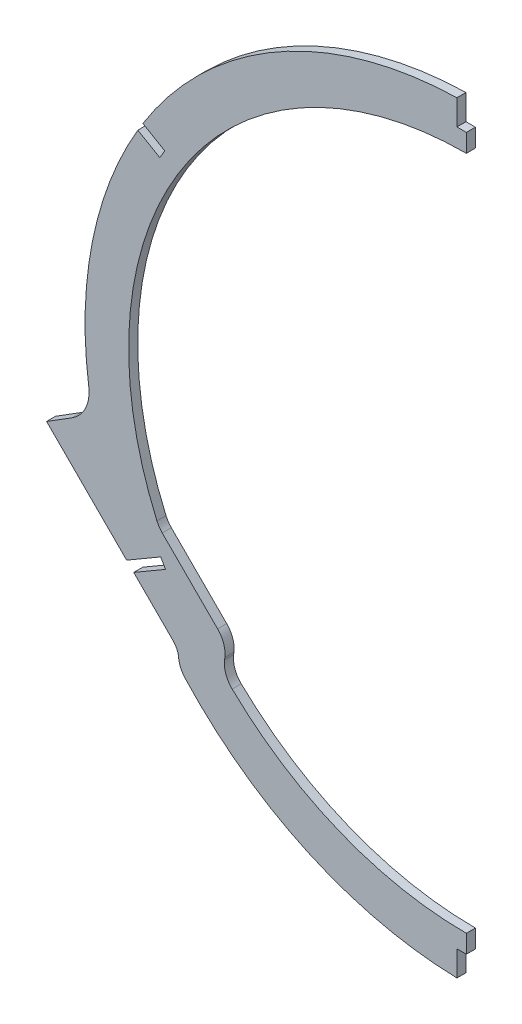
from build123d import *

# Parameters (mm, degrees)
BOSS_EXTRUDE1_DEPTH = 1.5875
CUT_EXTRUDE1_DEPTH  = 3.175
FILLET1_R           = 8.89
SKETCH3_W           = 234.443386257
SKETCH3_H           = 422.563019086
CUT_EXTRUDE2_DEPTH  = 206.876411182
BOSS_EXTRUDE2_DEPTH = 1.5875
FILLET2_R           = 6.35
FILLET3_R           = 12.7
SKETCH6_W           = 3.302
SKETCH6_H           = 12.7
CUT_EXTRUDE3_DEPTH  = 215.861709895


with BuildPart() as part:
    # Sketch1 → Boss-Extrude1 (new, symmetric)
    with BuildSketch(Plane.XY):
        with BuildLine():
            Line((-120.187952283, -34.272453), (-99.98237601, -54.478029272))
            Line((-99.98237601, -54.478029272), (-101.142590553, -63.40953887))
            ThreePointArc((-101.142590553, -63.40953887), (-81.179103762, -82.298079227), (-57.767453, -96.692952283))
            ThreePointArc((-57.767453, -96.692952283), (94.292689271, 117.787689271), (-120.187952283, -34.272453))
        make_face()
    extrude(amount=BOSS_EXTRUDE1_DEPTH, both=True)

    # Sketch2 → Cut-Extrude1 (cut)
    with BuildSketch(Plane.XY.offset(1.5875)):
        with BuildLine():
            Line((-83.903310386, -49.004480206), (-85.12178765, -58.384505172))
            ThreePointArc((-85.12178765, -58.384505172), (97.723123527, 89.828726174), (-107.51910025, -25.388690342))
            Line((-107.51910025, -25.388690342), (-83.903310386, -49.004480206))
        make_face()
    extrude(amount=-CUT_EXTRUDE1_DEPTH, mode=Mode.SUBTRACT)

    # Fillet1
    fillet1_edges = [part.edges().sort_by_distance(p)[0] for p in [
        (-83.903310386, -49.004480206, 0),
        (-107.51910025, -25.388690342, 0),
        (-85.12178765, -58.384505172, 0),
        (-99.98237601, -54.478029272, -0.79375),
        (-120.187952283, -34.272453, -0.79375),
        (-101.142590553, -63.40953887, -0.79375),
    ]]
    fillet(fillet1_edges, radius=FILLET1_R)

    # Sketch3 → Cut-Extrude2 (cut, through all)
    with BuildSketch(Plane(origin=(0, 0, 0), x_dir=(0, 0, -1), z_dir=(1, 0, 0))):
        with Locations((10.168628802, 16.433452221)):
            Rectangle(SKETCH3_W, SKETCH3_H)
    extrude(amount=CUT_EXTRUDE2_DEPTH, mode=Mode.SUBTRACT)

    # Sketch5 → Boss-Extrude2 (add, symmetric)
    with BuildSketch(Plane.XY):
        Polygon((-146.81661939, -13.003405573), (-125.293457687, 0.445758531), (-91.969146245, -50.60762416), (-100.600425128, -59.235866221), align=None)
    extrude(amount=BOSS_EXTRUDE2_DEPTH, both=True)

    # Fillet2
    # the kernel refuses this fillet: 6.35 mm, written as the material it adds along each edge
    with BuildSketch(Plane(origin=(-100.600425128, -59.235866221, -1.5875), x_dir=(-0.03079411224323655, -0.9995257488685076, 0), z_dir=(0, 0, 1)), Plane(origin=(-100.600425128, -59.235866221, 0), x_dir=(-0.03079411224323655, -0.9995257488685076, 0), z_dir=(0, 0, 1))) as fillet2_piece_1:
        with BuildLine():
            CenterArc((2.784435169, -6.30796831), FILLET2_R, 96.595975588, 40.158594829)
            Line((-1.841067542, -1.957425279), (-2.303617813, -1.522370976))
            Line((-2.303617813, -1.522370976), (-0.462550271, 0.435054303))
            Line((-0.462550271, 0.435054303), (0.062369909, 0.63192958))
            ThreePointArc((0.062369909, 0.63192958), (0.223047541, 0.61607109), (1.982086545, 0.630796831))
            Line((1.982086545, 0.630796831), (2.055027329, 0))
        make_face()
    extrude(amount=1.5875)

    # Fillet3
    fillet3_edges = [part.edges().sort_by_distance(p)[0] for p in [
        (-130.70446004, -2.935411002, 0),
    ]]
    fillet(fillet3_edges, radius=FILLET3_R)

    # Sketch6 → Cut-Extrude3 (cut, through all)
    with BuildSketch(Plane(origin=(0, 0, -1.5875), x_dir=(-1, 0, 0), z_dir=(0, 0, -1))):
        with Locations((1.651, 154.305)):
            Rectangle(SKETCH6_W, SKETCH6_H)
        Polygon((105.489605782, 89.621888205), (107.18979641, 86.702712453), (118.164141341, 93.094406542), (116.463950713, 96.013582294), align=None)
        Polygon((105.201667309, -36.998635355), (106.90185793, -34.079459599), (128.850547824, -46.862847722), (127.150357204, -49.782023478), align=None)
        with Locations((1.651, -107.315)):
            Rectangle(SKETCH6_W, SKETCH6_H)
    extrude(amount=-CUT_EXTRUDE3_DEPTH, mode=Mode.SUBTRACT)


solid = part.part
